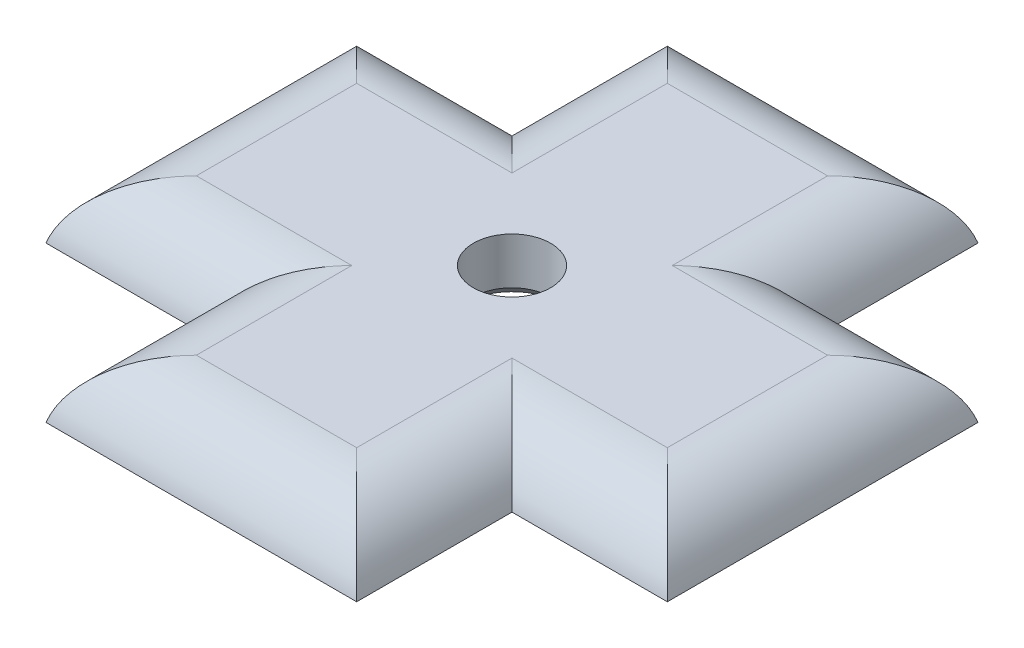
from build123d import *

# Parameters (mm, degrees)
BOSS_EXTRUDE1_DEPTH = 7.5
FILLET1_R           = 10
SKETCH2_R           = 4.975
CUT_EXTRUDE1_DEPTH  = 7.5
CHAMFER1_SIZE       = 1.5


with BuildPart() as part:
    # Sketch1 → Boss-Extrude1 (new body)
    with BuildSketch(Plane(origin=(0, 0, 0), x_dir=(1, 0, 0), z_dir=(0, 1, 0))):
        Polygon((60, 0), (20, 0), (20, -20), (0, -20), (0, -60), (20, -60), (20, -80), (60, -80), (60, -60), (80, -60), (80, -20), (60, -20), align=None)
    extrude(amount=BOSS_EXTRUDE1_DEPTH)

    # Fillet1
    # the kernel refuses this fillet: 10 mm, written as the material it takes off along each edge
    with BuildSketch(Plane(origin=(20, 7.5, -24.206145914), x_dir=(0, -1, 0), z_dir=(0, 0, 1)), Plane(origin=(60, 7.5, 20), x_dir=(0, -1, 0), z_dir=(0, 0, -1)), Plane(origin=(104.206145914, 7.5, 20), x_dir=(0, -1, 0), z_dir=(-1, 0, 0)), Plane(origin=(60, 7.5, 60), x_dir=(0, -1, 0), z_dir=(1, 0, 0)), Plane(origin=(60, 7.5, 104.206145914), x_dir=(0, -1, 0), z_dir=(0, 0, -1)), Plane(origin=(20, 7.5, 60), x_dir=(0, -1, 0), z_dir=(0, 0, 1)), Plane(origin=(-24.206145914, 7.5, 60), x_dir=(0, -1, 0), z_dir=(1, 0, 0)), Plane(origin=(20, 7.5, 20), x_dir=(0, -1, 0), z_dir=(-1, 0, 0))) as fillet1_piece_1:
        with BuildLine():
            CenterArc((10, 9.682458366), FILLET1_R, 180, 75.522487814)
            Line((0, 9.682458366), (-0.2, 9.682458366))
            Line((-0.2, 9.682458366), (-0.2, 0))
            Line((-0.2, 0), (0, -0.2))
            ThreePointArc((0, -0.2), (3.75, -0.2), (7.45, -0.193649167))
            Line((7.45, -0.193649167), (7.5, 0))
        make_face()
    extrude(amount=44.206145914, mode=Mode.SUBTRACT)
    with BuildSketch(Plane(origin=(84.206145914, 7.5, 0), x_dir=(0, -1, 0), z_dir=(-1, 0, 0)), Plane(origin=(80, 7.5, 84.206145914), x_dir=(0, -1, 0), z_dir=(0, 0, -1)), Plane(origin=(-4.206145914, 7.5, 80), x_dir=(0, -1, 0), z_dir=(1, 0, 0)), Plane(origin=(0, 7.5, -4.206145914), x_dir=(0, -1, 0), z_dir=(0, 0, 1))) as fillet1_piece_2:
        with BuildLine():
            CenterArc((10, 9.682458366), FILLET1_R, 180, 75.522487814)
            Line((0, 9.682458366), (-0.2, 9.682458366))
            Line((-0.2, 9.682458366), (-0.2, 0))
            Line((-0.2, 0), (0, -0.2))
            ThreePointArc((0, -0.2), (3.75, -0.2), (7.45, -0.193649167))
            Line((7.45, -0.193649167), (7.5, 0))
        make_face()
    extrude(amount=88.412291828, mode=Mode.SUBTRACT)
    with BuildSketch(Plane(origin=(20, 7.5, -24.206145914), x_dir=(0, -1, 0), z_dir=(0, 0, 1))) as fillet1_piece_3a_section:
        with BuildLine():
            CenterArc((10, 9.682458366), FILLET1_R, 180, 75.522487814)
            Line((0, 9.682458366), (-0.2, 9.682458366))
            Line((-0.2, 9.682458366), (-0.2, 0))
            Line((-0.2, 0), (0, -0.2))
            ThreePointArc((0, -0.2), (3.75, -0.2), (7.45, -0.193649167))
            Line((7.45, -0.193649167), (7.5, 0))
        make_face()
    fillet1_piece_3a = extrude(amount=68.412291828, mode=Mode.PRIVATE)
    fillet1_piece_3a = split(fillet1_piece_3a, bisect_by=Plane(origin=(22.281441008, 5.604082443, 20), z_dir=(0, 0, 1)), keep=Keep.TOP, mode=Mode.PRIVATE)
    with BuildSketch(Plane(origin=(44.206145914, 7.5, 20), x_dir=(0, -1, 0), z_dir=(-1, 0, 0))) as fillet1_piece_3b_section:
        with BuildLine():
            CenterArc((10, 9.682458366), FILLET1_R, 180, 75.522487814)
            Line((0, 9.682458366), (-0.2, 9.682458366))
            Line((-0.2, 9.682458366), (-0.2, 0))
            Line((-0.2, 0), (0, -0.2))
            ThreePointArc((0, -0.2), (3.75, -0.2), (7.45, -0.193649167))
            Line((7.45, -0.193649167), (7.5, 0))
        make_face()
    fillet1_piece_3b = extrude(amount=68.412291828, mode=Mode.PRIVATE)
    fillet1_piece_3b = split(fillet1_piece_3b, bisect_by=Plane(origin=(20, 5.604082443, 22.281441008), z_dir=(1, 0, 0)), keep=Keep.TOP, mode=Mode.PRIVATE)
    fillet1_piece_3 = fillet1_piece_3a & fillet1_piece_3b
    add(fillet1_piece_3, mode=Mode.SUBTRACT)
    with BuildSketch(Plane(origin=(104.206145914, 7.5, 20), x_dir=(0, -1, 0), z_dir=(-1, 0, 0))) as fillet1_piece_4a_section:
        with BuildLine():
            CenterArc((10, 9.682458366), FILLET1_R, 180, 75.522487814)
            Line((0, 9.682458366), (-0.2, 9.682458366))
            Line((-0.2, 9.682458366), (-0.2, 0))
            Line((-0.2, 0), (0, -0.2))
            ThreePointArc((0, -0.2), (3.75, -0.2), (7.45, -0.193649167))
            Line((7.45, -0.193649167), (7.5, 0))
        make_face()
    fillet1_piece_4a = extrude(amount=68.412291828, mode=Mode.PRIVATE)
    fillet1_piece_4a = split(fillet1_piece_4a, bisect_by=Plane(origin=(60, 5.604082443, 22.281441008), z_dir=(-1, 0, 0)), keep=Keep.TOP, mode=Mode.PRIVATE)
    with BuildSketch(Plane(origin=(60, 7.5, 44.206145914), x_dir=(0, -1, 0), z_dir=(0, 0, -1))) as fillet1_piece_4b_section:
        with BuildLine():
            CenterArc((10, 9.682458366), FILLET1_R, 180, 75.522487814)
            Line((0, 9.682458366), (-0.2, 9.682458366))
            Line((-0.2, 9.682458366), (-0.2, 0))
            Line((-0.2, 0), (0, -0.2))
            ThreePointArc((0, -0.2), (3.75, -0.2), (7.45, -0.193649167))
            Line((7.45, -0.193649167), (7.5, 0))
        make_face()
    fillet1_piece_4b = extrude(amount=68.412291828, mode=Mode.PRIVATE)
    fillet1_piece_4b = split(fillet1_piece_4b, bisect_by=Plane(origin=(57.718558992, 5.604082443, 20), z_dir=(0, 0, 1)), keep=Keep.TOP, mode=Mode.PRIVATE)
    fillet1_piece_4 = fillet1_piece_4a & fillet1_piece_4b
    add(fillet1_piece_4, mode=Mode.SUBTRACT)
    with BuildSketch(Plane(origin=(60, 7.5, 104.206145914), x_dir=(0, -1, 0), z_dir=(0, 0, -1))) as fillet1_piece_5a_section:
        with BuildLine():
            CenterArc((10, 9.682458366), FILLET1_R, 180, 75.522487814)
            Line((0, 9.682458366), (-0.2, 9.682458366))
            Line((-0.2, 9.682458366), (-0.2, 0))
            Line((-0.2, 0), (0, -0.2))
            ThreePointArc((0, -0.2), (3.75, -0.2), (7.45, -0.193649167))
            Line((7.45, -0.193649167), (7.5, 0))
        make_face()
    fillet1_piece_5a = extrude(amount=68.412291828, mode=Mode.PRIVATE)
    fillet1_piece_5a = split(fillet1_piece_5a, bisect_by=Plane(origin=(57.718558992, 5.604082443, 60), z_dir=(0, 0, -1)), keep=Keep.TOP, mode=Mode.PRIVATE)
    with BuildSketch(Plane(origin=(35.793854086, 7.5, 60), x_dir=(0, -1, 0), z_dir=(1, 0, 0))) as fillet1_piece_5b_section:
        with BuildLine():
            CenterArc((10, 9.682458366), FILLET1_R, 180, 75.522487814)
            Line((0, 9.682458366), (-0.2, 9.682458366))
            Line((-0.2, 9.682458366), (-0.2, 0))
            Line((-0.2, 0), (0, -0.2))
            ThreePointArc((0, -0.2), (3.75, -0.2), (7.45, -0.193649167))
            Line((7.45, -0.193649167), (7.5, 0))
        make_face()
    fillet1_piece_5b = extrude(amount=68.412291828, mode=Mode.PRIVATE)
    fillet1_piece_5b = split(fillet1_piece_5b, bisect_by=Plane(origin=(60, 5.604082443, 57.718558992), z_dir=(-1, 0, 0)), keep=Keep.TOP, mode=Mode.PRIVATE)
    fillet1_piece_5 = fillet1_piece_5a & fillet1_piece_5b
    add(fillet1_piece_5, mode=Mode.SUBTRACT)
    with BuildSketch(Plane(origin=(-24.206145914, 7.5, 60), x_dir=(0, -1, 0), z_dir=(1, 0, 0))) as fillet1_piece_6a_section:
        with BuildLine():
            CenterArc((10, 9.682458366), FILLET1_R, 180, 75.522487814)
            Line((0, 9.682458366), (-0.2, 9.682458366))
            Line((-0.2, 9.682458366), (-0.2, 0))
            Line((-0.2, 0), (0, -0.2))
            ThreePointArc((0, -0.2), (3.75, -0.2), (7.45, -0.193649167))
            Line((7.45, -0.193649167), (7.5, 0))
        make_face()
    fillet1_piece_6a = extrude(amount=68.412291828, mode=Mode.PRIVATE)
    fillet1_piece_6a = split(fillet1_piece_6a, bisect_by=Plane(origin=(20, 5.604082443, 57.718558992), z_dir=(1, 0, 0)), keep=Keep.TOP, mode=Mode.PRIVATE)
    with BuildSketch(Plane(origin=(20, 7.5, 35.793854086), x_dir=(0, -1, 0), z_dir=(0, 0, 1))) as fillet1_piece_6b_section:
        with BuildLine():
            CenterArc((10, 9.682458366), FILLET1_R, 180, 75.522487814)
            Line((0, 9.682458366), (-0.2, 9.682458366))
            Line((-0.2, 9.682458366), (-0.2, 0))
            Line((-0.2, 0), (0, -0.2))
            ThreePointArc((0, -0.2), (3.75, -0.2), (7.45, -0.193649167))
            Line((7.45, -0.193649167), (7.5, 0))
        make_face()
    fillet1_piece_6b = extrude(amount=68.412291828, mode=Mode.PRIVATE)
    fillet1_piece_6b = split(fillet1_piece_6b, bisect_by=Plane(origin=(22.281441008, 5.604082443, 60), z_dir=(0, 0, -1)), keep=Keep.TOP, mode=Mode.PRIVATE)
    fillet1_piece_6 = fillet1_piece_6a & fillet1_piece_6b
    add(fillet1_piece_6, mode=Mode.SUBTRACT)

    # Sketch2 → Cut-Extrude1 (cut)
    with BuildSketch(Plane(origin=(0, 0, 0), x_dir=(1, 0, 0), z_dir=(0, 1, 0))):
        with Locations(Location((40, -40, 0), (0, 0, 270))):
            Circle(SKETCH2_R)
    extrude(amount=CUT_EXTRUDE1_DEPTH, mode=Mode.SUBTRACT)

    # Chamfer1
    chamfer1_edges = [part.edges().sort_by_distance(p)[0] for p in [
        (40, 0, 35.025),
    ]]
    chamfer(chamfer1_edges, length=CHAMFER1_SIZE)


solid = part.part
